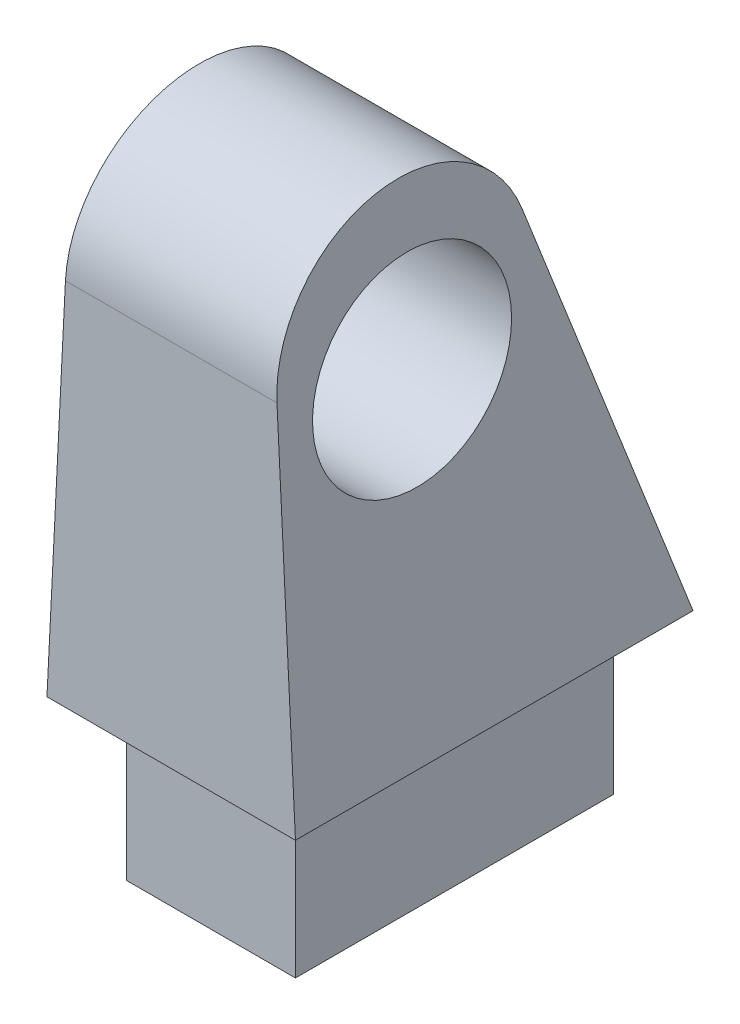
from build123d import *

# Parameters (mm, degrees)
SKETCH1_R           = 3.175
BOSS_EXTRUDE1_DEPTH = 7.9375
SKETCH2_OUTSIDE_W   = 14.302
SKETCH2_OUTSIDE_H   = 22.239
CUT_EXTRUDE1_DEPTH  = 22.824516747
SKETCH3_W           = 5.3975
SKETCH3_H           = 10.16
BOSS_EXTRUDE2_DEPTH = 5.08


with BuildPart() as part:
    # Sketch1 → Boss-Extrude1 (new body)
    with BuildSketch(Plane(origin=(0, 0, 0), x_dir=(0, 0, -1), z_dir=(1, 0, 0))):
        with BuildLine():
            Line((1.546976538, 13.196198506), (6.35, 0))
            Line((6.35, 0), (-6.35, 0))
            Line((-6.35, 0), (-6.35, 11.803748476))
            ThreePointArc((-6.35, 11.803748476), (-2.985713884, 15.813148541), (1.546976538, 13.196198506))
        make_face()
        with Locations((-2.094131542, 10.627495109)):
            Circle(SKETCH1_R, mode=Mode.SUBTRACT)
    extrude(amount=BOSS_EXTRUDE1_DEPTH)

    # Sketch2 outside → Cut-Extrude1 (cut, through all)
    with BuildSketch(Plane.XY.offset(6.35)):
        with Locations((3.969, 7.9375)):
            Rectangle(SKETCH2_OUTSIDE_W, SKETCH2_OUTSIDE_H)
        Polygon((0, 0), (7.9375, 0), (7.14375, 15.875), (0.79375, 15.875), align=None, mode=Mode.SUBTRACT)
    extrude(amount=-CUT_EXTRUDE1_DEPTH, mode=Mode.SUBTRACT)

    # Sketch3 → Boss-Extrude2 (add)
    with BuildSketch(Plane.XZ):
        with Locations((3.96875, 0)):
            Rectangle(SKETCH3_W, SKETCH3_H)
    extrude(amount=BOSS_EXTRUDE2_DEPTH)


solid = part.part
